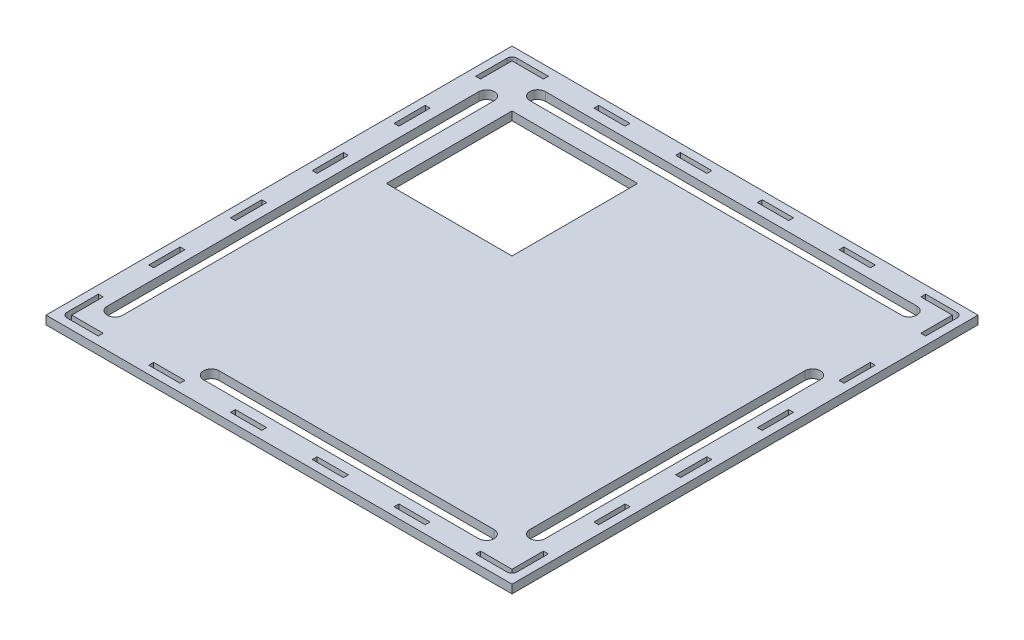
from build123d import *

# Parameters (mm, degrees)
BOSS_EXTRUDE1_OUTLINE_W   = 296.4
BOSS_EXTRUDE1_OUTLINE_H   = 296.4
BOSS_EXTRUDE1_OUTLINE_W_2 = 20
BOSS_EXTRUDE1_OUTLINE_H_2 = 3.175
BOSS_EXTRUDE1_OUTLINE_W_3 = 3.175
BOSS_EXTRUDE1_OUTLINE_H_3 = 20
BOSS_EXTRUDE1_DEPTH       = 5.4
SKETCH3_W                 = 10
SKETCH3_H                 = 236.4
SKETCH3_W_2               = 236.4
SKETCH3_H_2               = 10
SKETCH3_W_3               = 80
SKETCH3_H_3               = 80
SKETCH3_H_4               = 175
SKETCH3_W_4               = 175
CUT_EXTRUDE5_DEPTH        = 10
SKETCH5_W                 = 296.48128
SKETCH5_H                 = 296.48128
SKETCH5_W_2               = 79.91872
SKETCH5_H_2               = 79.91872
SKETCH5_W_3               = 19.91872
SKETCH5_H_3               = 3.09372
SKETCH5_W_4               = 3.09372
SKETCH5_H_4               = 19.91872
BOSS_EXTRUDE2_DEPTH       = 5.4


# Read off the part's stored shape, not the designer's step: Boss-Extrude1
with BuildPart() as part:
    # Boss-Extrude1 outline → Boss-Extrude1 (new body)
    with BuildSketch(Plane(origin=(0, 0, 0), x_dir=(1, 0, 0), z_dir=(0, 1, 0))):
        with Locations((148.2, 148.2)):
            Rectangle(BOSS_EXTRUDE1_OUTLINE_W, BOSS_EXTRUDE1_OUTLINE_H)
        with BuildLine():
            Line((28.175, 5.025), (8.175, 5.025))
            ThreePointArc((8.175, 5.025), (5.92993597, 5.95493597), (5, 8.2))
            Line((5, 8.2), (5, 28.2))
            Line((5, 28.2), (8.175, 28.2))
            Line((8.175, 28.2), (8.175, 8.2))
            Line((8.175, 8.2), (28.175, 8.2))
            Line((28.175, 8.2), (28.175, 5.025))
        make_face(mode=Mode.SUBTRACT)
        with Locations((70.18, 6.6125)):
            Rectangle(BOSS_EXTRUDE1_OUTLINE_W_2, BOSS_EXTRUDE1_OUTLINE_H_2, mode=Mode.SUBTRACT)
        with Locations((6.5875, 70.205)):
            Rectangle(BOSS_EXTRUDE1_OUTLINE_W_3, BOSS_EXTRUDE1_OUTLINE_H_3, mode=Mode.SUBTRACT)
        with Locations((122.185, 6.6125)):
            Rectangle(BOSS_EXTRUDE1_OUTLINE_W_2, BOSS_EXTRUDE1_OUTLINE_H_2, mode=Mode.SUBTRACT)
        with Locations((6.5875, 122.21)):
            Rectangle(BOSS_EXTRUDE1_OUTLINE_W_3, BOSS_EXTRUDE1_OUTLINE_H_3, mode=Mode.SUBTRACT)
        with Locations((174.19, 6.6125)):
            Rectangle(BOSS_EXTRUDE1_OUTLINE_W_2, BOSS_EXTRUDE1_OUTLINE_H_2, mode=Mode.SUBTRACT)
        with Locations((226.195, 6.6125)):
            Rectangle(BOSS_EXTRUDE1_OUTLINE_W_2, BOSS_EXTRUDE1_OUTLINE_H_2, mode=Mode.SUBTRACT)
        with BuildLine():
            Line((291.375, 28.2), (291.375, 8.2))
            ThreePointArc((291.375, 8.2), (290.44506403, 5.95493597), (288.2, 5.025))
            Line((288.2, 5.025), (268.2, 5.025))
            Line((268.2, 5.025), (268.2, 8.2))
            Line((268.2, 8.2), (288.2, 8.2))
            Line((288.2, 8.2), (288.2, 28.2))
            Line((288.2, 28.2), (291.375, 28.2))
        make_face(mode=Mode.SUBTRACT)
        with Locations((289.7875, 70.205)):
            Rectangle(BOSS_EXTRUDE1_OUTLINE_W_3, BOSS_EXTRUDE1_OUTLINE_H_3, mode=Mode.SUBTRACT)
        with Locations((289.7875, 122.21)):
            Rectangle(BOSS_EXTRUDE1_OUTLINE_W_3, BOSS_EXTRUDE1_OUTLINE_H_3, mode=Mode.SUBTRACT)
        with Locations((6.5875, 174.215)):
            Rectangle(BOSS_EXTRUDE1_OUTLINE_W_3, BOSS_EXTRUDE1_OUTLINE_H_3, mode=Mode.SUBTRACT)
        with Locations((6.5875, 226.22)):
            Rectangle(BOSS_EXTRUDE1_OUTLINE_W_3, BOSS_EXTRUDE1_OUTLINE_H_3, mode=Mode.SUBTRACT)
        with BuildLine():
            Line((5, 268.225), (5, 288.225))
            ThreePointArc((5, 288.225), (5.92993597, 290.47006403), (8.175, 291.4))
            Line((8.175, 291.4), (28.175, 291.4))
            Line((28.175, 291.4), (28.175, 288.225))
            Line((28.175, 288.225), (8.175, 288.225))
            Line((8.175, 288.225), (8.175, 268.225))
            Line((8.175, 268.225), (5, 268.225))
        make_face(mode=Mode.SUBTRACT)
        with Locations((70.18, 289.8125)):
            Rectangle(BOSS_EXTRUDE1_OUTLINE_W_2, BOSS_EXTRUDE1_OUTLINE_H_2, mode=Mode.SUBTRACT)
        with Locations((122.185, 289.8125)):
            Rectangle(BOSS_EXTRUDE1_OUTLINE_W_2, BOSS_EXTRUDE1_OUTLINE_H_2, mode=Mode.SUBTRACT)
        with Locations((289.7875, 174.215)):
            Rectangle(BOSS_EXTRUDE1_OUTLINE_W_3, BOSS_EXTRUDE1_OUTLINE_H_3, mode=Mode.SUBTRACT)
        with Locations((174.19, 289.8125)):
            Rectangle(BOSS_EXTRUDE1_OUTLINE_W_2, BOSS_EXTRUDE1_OUTLINE_H_2, mode=Mode.SUBTRACT)
        with Locations((289.7875, 226.22)):
            Rectangle(BOSS_EXTRUDE1_OUTLINE_W_3, BOSS_EXTRUDE1_OUTLINE_H_3, mode=Mode.SUBTRACT)
        with Locations((226.195, 289.8125)):
            Rectangle(BOSS_EXTRUDE1_OUTLINE_W_2, BOSS_EXTRUDE1_OUTLINE_H_2, mode=Mode.SUBTRACT)
        with BuildLine():
            Line((268.2, 291.4), (288.2, 291.4))
            ThreePointArc((288.2, 291.4), (290.44506403, 290.47006403), (291.375, 288.225))
            Line((291.375, 288.225), (291.375, 268.225))
            Line((291.375, 268.225), (288.2, 268.225))
            Line((288.2, 268.225), (288.2, 288.225))
            Line((288.2, 288.225), (268.2, 288.225))
            Line((268.2, 288.225), (268.2, 291.4))
        make_face(mode=Mode.SUBTRACT)
    extrude(amount=BOSS_EXTRUDE1_DEPTH)

    # Sketch3 → Cut-Extrude5 (cut)
    with BuildSketch(Plane(origin=(0, 5.4, 0), x_dir=(1, 0, 0), z_dir=(0, 1, 0))):
        with BuildLine():
            ThreePointArc((24.475, 24.35), (19.475, 19.35), (14.475, 24.35))
            Line((14.475, 24.35), (24.475, 24.35))
        make_face()
        with Locations((19.475, 142.55)):
            Rectangle(SKETCH3_W, SKETCH3_H)
        with BuildLine():
            Line((24.475, 260.75), (14.475, 260.75))
            ThreePointArc((14.475, 260.75), (19.475, 265.75), (24.475, 260.75))
        make_face()
        with BuildLine():
            Line((35.65, 282.025), (35.65, 272.025))
            ThreePointArc((35.65, 272.025), (30.65, 277.025), (35.65, 282.025))
        make_face()
        with Locations((153.85, 277.025)):
            Rectangle(SKETCH3_W_2, SKETCH3_H_2)
        with BuildLine():
            ThreePointArc((272.05, 282.025), (277.05, 277.025), (272.05, 272.025))
            Line((272.05, 272.025), (272.05, 282.025))
        make_face()
        with Locations((75.675, 220.725)):
            Rectangle(SKETCH3_W_3, SKETCH3_H_3)
        with Locations((276.95, 123.2)):
            Rectangle(SKETCH3_W, SKETCH3_H_4)
        with BuildLine():
            Line((281.95, 210.7), (271.95, 210.7))
            ThreePointArc((271.95, 210.7), (276.95, 215.7), (281.95, 210.7))
        make_face()
        with BuildLine():
            ThreePointArc((281.95, 35.7), (276.95, 30.7), (271.95, 35.7))
            Line((271.95, 35.7), (281.95, 35.7))
        make_face()
        with BuildLine():
            ThreePointArc((260.7, 24.4), (265.7, 19.4), (260.7, 14.4))
            Line((260.7, 14.4), (260.7, 24.4))
        make_face()
        with Locations((173.2, 19.4)):
            Rectangle(SKETCH3_W_4, SKETCH3_H_2)
        with BuildLine():
            Line((85.7, 14.4), (85.7, 24.4))
            ThreePointArc((85.7, 24.4), (80.7, 19.4), (85.7, 14.4))
        make_face()
    extrude(amount=-CUT_EXTRUDE5_DEPTH, mode=Mode.SUBTRACT)

    # Sketch5 → Boss-Extrude2 (add)
    with BuildSketch(Plane(origin=(0, 5.4, 0), x_dir=(1, 0, 0), z_dir=(0, 1, 0))):
        with Locations((148.2, 148.2)):
            Rectangle(SKETCH5_W, SKETCH5_H)
        with BuildLine():
            Line((24.43436, 24.35), (24.43436, 260.75))
            ThreePointArc((24.43436, 260.75), (19.475, 265.70936), (14.51564, 260.75))
            Line((14.51564, 260.75), (14.51564, 24.35))
            ThreePointArc((14.51564, 24.35), (19.475, 19.39064), (24.43436, 24.35))
        make_face(mode=Mode.SUBTRACT)
        with Locations((75.675, 220.725)):
            Rectangle(SKETCH5_W_2, SKETCH5_H_2, mode=Mode.SUBTRACT)
        with BuildLine():
            Line((291.33436, 268.26564), (291.33436, 288.225))
            ThreePointArc((291.33436, 288.225), (290.416327211, 290.441327211), (288.2, 291.35936))
            Line((288.2, 291.35936), (268.24064, 291.35936))
            Line((268.24064, 291.35936), (268.24064, 288.26564))
            Line((268.24064, 288.26564), (288.24064, 288.26564))
            Line((288.24064, 288.26564), (288.24064, 268.26564))
            Line((288.24064, 268.26564), (291.33436, 268.26564))
        make_face(mode=Mode.SUBTRACT)
        with BuildLine():
            Line((268.24064, 5.06564), (288.2, 5.06564))
            ThreePointArc((288.2, 5.06564), (290.416327211, 5.983672789), (291.33436, 8.2))
            Line((291.33436, 8.2), (291.33436, 28.15936))
            Line((291.33436, 28.15936), (288.24064, 28.15936))
            Line((288.24064, 28.15936), (288.24064, 8.15936))
            Line((288.24064, 8.15936), (268.24064, 8.15936))
            Line((268.24064, 8.15936), (268.24064, 5.06564))
        make_face(mode=Mode.SUBTRACT)
        with BuildLine():
            Line((5.04064, 28.15936), (5.04064, 8.2))
            ThreePointArc((5.04064, 8.2), (5.958672789, 5.983672789), (8.175, 5.06564))
            Line((8.175, 5.06564), (28.13436, 5.06564))
            Line((28.13436, 5.06564), (28.13436, 8.15936))
            Line((28.13436, 8.15936), (8.13436, 8.15936))
            Line((8.13436, 8.15936), (8.13436, 28.15936))
            Line((8.13436, 28.15936), (5.04064, 28.15936))
        make_face(mode=Mode.SUBTRACT)
        with Locations((70.18, 289.8125)):
            Rectangle(SKETCH5_W_3, SKETCH5_H_3, mode=Mode.SUBTRACT)
        with Locations((122.185, 289.8125)):
            Rectangle(SKETCH5_W_3, SKETCH5_H_3, mode=Mode.SUBTRACT)
        with Locations((174.19, 289.8125)):
            Rectangle(SKETCH5_W_3, SKETCH5_H_3, mode=Mode.SUBTRACT)
        with Locations((226.195, 289.8125)):
            Rectangle(SKETCH5_W_3, SKETCH5_H_3, mode=Mode.SUBTRACT)
        with Locations((289.7875, 226.22)):
            Rectangle(SKETCH5_W_4, SKETCH5_H_4, mode=Mode.SUBTRACT)
        with Locations((289.7875, 174.215)):
            Rectangle(SKETCH5_W_4, SKETCH5_H_4, mode=Mode.SUBTRACT)
        with Locations((289.7875, 122.21)):
            Rectangle(SKETCH5_W_4, SKETCH5_H_4, mode=Mode.SUBTRACT)
        with Locations((289.7875, 70.205)):
            Rectangle(SKETCH5_W_4, SKETCH5_H_4, mode=Mode.SUBTRACT)
        with Locations((6.5875, 226.22)):
            Rectangle(SKETCH5_W_4, SKETCH5_H_4, mode=Mode.SUBTRACT)
        with Locations((6.5875, 174.215)):
            Rectangle(SKETCH5_W_4, SKETCH5_H_4, mode=Mode.SUBTRACT)
        with Locations((6.5875, 122.21)):
            Rectangle(SKETCH5_W_4, SKETCH5_H_4, mode=Mode.SUBTRACT)
        with Locations((6.5875, 70.205)):
            Rectangle(SKETCH5_W_4, SKETCH5_H_4, mode=Mode.SUBTRACT)
        with Locations((70.18, 6.6125)):
            Rectangle(SKETCH5_W_3, SKETCH5_H_3, mode=Mode.SUBTRACT)
        with Locations((122.185, 6.6125)):
            Rectangle(SKETCH5_W_3, SKETCH5_H_3, mode=Mode.SUBTRACT)
        with Locations((174.19, 6.6125)):
            Rectangle(SKETCH5_W_3, SKETCH5_H_3, mode=Mode.SUBTRACT)
        with Locations((226.195, 6.6125)):
            Rectangle(SKETCH5_W_3, SKETCH5_H_3, mode=Mode.SUBTRACT)
        with BuildLine():
            Line((271.99064, 210.7), (271.99064, 35.7))
            ThreePointArc((271.99064, 35.7), (276.95, 30.74064), (281.90936, 35.7))
            Line((281.90936, 35.7), (281.90936, 210.7))
            ThreePointArc((281.90936, 210.7), (276.95, 215.65936), (271.99064, 210.7))
        make_face(mode=Mode.SUBTRACT)
        with BuildLine():
            Line((5.04064, 288.225), (5.04064, 268.26564))
            Line((5.04064, 268.26564), (8.13436, 268.26564))
            Line((8.13436, 268.26564), (8.13436, 288.26564))
            Line((8.13436, 288.26564), (28.13436, 288.26564))
            Line((28.13436, 288.26564), (28.13436, 291.35936))
            Line((28.13436, 291.35936), (8.175, 291.35936))
            ThreePointArc((8.175, 291.35936), (5.958672789, 290.441327211), (5.04064, 288.225))
        make_face(mode=Mode.SUBTRACT)
        with BuildLine():
            Line((260.7, 24.35936), (85.7, 24.35936))
            ThreePointArc((85.7, 24.35936), (80.74064, 19.4), (85.7, 14.44064))
            Line((85.7, 14.44064), (260.7, 14.44064))
            ThreePointArc((260.7, 14.44064), (265.65936, 19.4), (260.7, 24.35936))
        make_face(mode=Mode.SUBTRACT)
        with BuildLine():
            Line((272.05, 281.98436), (35.65, 281.98436))
            ThreePointArc((35.65, 281.98436), (30.69064, 277.025), (35.65, 272.06564))
            Line((35.65, 272.06564), (272.05, 272.06564))
            ThreePointArc((272.05, 272.06564), (277.00936, 277.025), (272.05, 281.98436))
        make_face(mode=Mode.SUBTRACT)
    extrude(amount=-BOSS_EXTRUDE2_DEPTH)


solid = part.part
